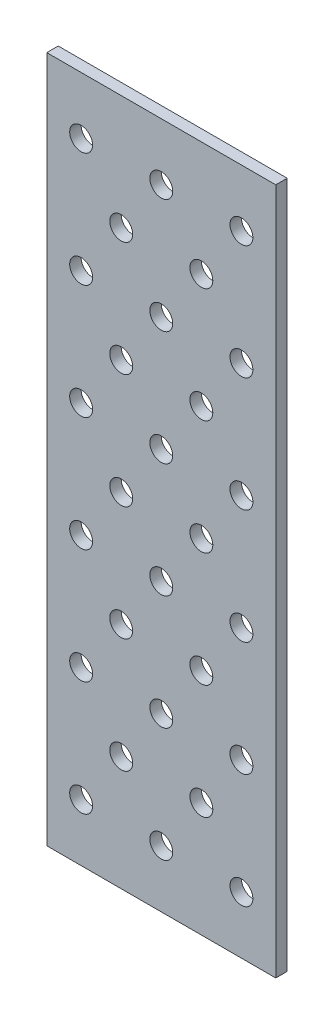
from build123d import *

# Parameters (mm, degrees)
SKETCH1_W          = 40
SKETCH1_H          = 120
SKETCH1_R          = 2
BASE_FLANGE1_DEPTH = 2


# Sheet-metal steps are written as plain solids
with BuildPart() as part:
    # Sketch1 → Base-Flange1 (new body)
    with BuildSketch(Plane.XY):
        Rectangle(SKETCH1_W, SKETCH1_H)
        with Locations((-14, 50)):
            Circle(SKETCH1_R, mode=Mode.SUBTRACT)
        with Locations((0, 50)):
            Circle(SKETCH1_R, mode=Mode.SUBTRACT)
        with Locations((14, 50)):
            Circle(SKETCH1_R, mode=Mode.SUBTRACT)
        with Locations((-7, 40)):
            Circle(SKETCH1_R, mode=Mode.SUBTRACT)
        with Locations((7, 40)):
            Circle(SKETCH1_R, mode=Mode.SUBTRACT)
        with Locations((-14, 30)):
            Circle(SKETCH1_R, mode=Mode.SUBTRACT)
        with Locations((-7, 20)):
            Circle(SKETCH1_R, mode=Mode.SUBTRACT)
        with Locations((7, 20)):
            Circle(SKETCH1_R, mode=Mode.SUBTRACT)
        with Locations((0, 30)):
            Circle(SKETCH1_R, mode=Mode.SUBTRACT)
        with Locations((14, 30)):
            Circle(SKETCH1_R, mode=Mode.SUBTRACT)
        with Locations((-14, 10)):
            Circle(SKETCH1_R, mode=Mode.SUBTRACT)
        with Locations((-7, 0)):
            Circle(SKETCH1_R, mode=Mode.SUBTRACT)
        with Locations((7, 0)):
            Circle(SKETCH1_R, mode=Mode.SUBTRACT)
        with Locations((0, 10)):
            Circle(SKETCH1_R, mode=Mode.SUBTRACT)
        with Locations((14, 10)):
            Circle(SKETCH1_R, mode=Mode.SUBTRACT)
        with Locations((-14, -10)):
            Circle(SKETCH1_R, mode=Mode.SUBTRACT)
        with Locations((-7, -20)):
            Circle(SKETCH1_R, mode=Mode.SUBTRACT)
        with Locations((7, -20)):
            Circle(SKETCH1_R, mode=Mode.SUBTRACT)
        with Locations((0, -10)):
            Circle(SKETCH1_R, mode=Mode.SUBTRACT)
        with Locations((14, -10)):
            Circle(SKETCH1_R, mode=Mode.SUBTRACT)
        with Locations((-14, -30)):
            Circle(SKETCH1_R, mode=Mode.SUBTRACT)
        with Locations((-7, -40)):
            Circle(SKETCH1_R, mode=Mode.SUBTRACT)
        with Locations((7, -40)):
            Circle(SKETCH1_R, mode=Mode.SUBTRACT)
        with Locations((0, -30)):
            Circle(SKETCH1_R, mode=Mode.SUBTRACT)
        with Locations((14, -30)):
            Circle(SKETCH1_R, mode=Mode.SUBTRACT)
        with Locations((-14, -50)):
            Circle(SKETCH1_R, mode=Mode.SUBTRACT)
        with Locations((0, -50)):
            Circle(SKETCH1_R, mode=Mode.SUBTRACT)
        with Locations((14, -50)):
            Circle(SKETCH1_R, mode=Mode.SUBTRACT)
    extrude(amount=-BASE_FLANGE1_DEPTH)


solid = part.part
